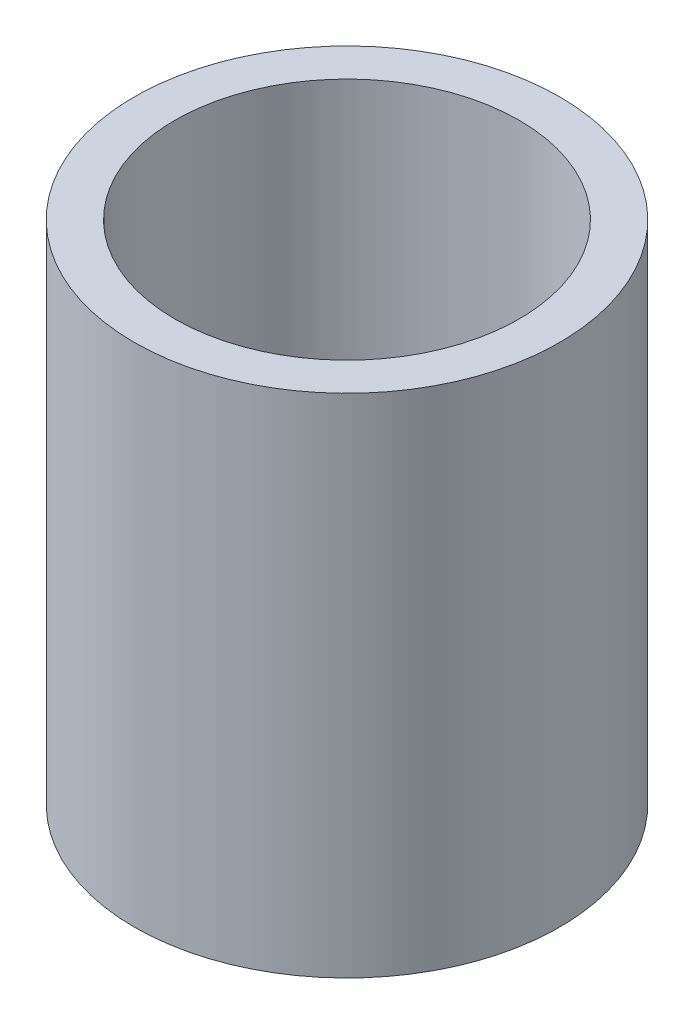
from build123d import *

# Parameters (mm, degrees)
SKETCH1_R           = 3.15
SKETCH1_R_2         = 2.55
BOSS_EXTRUDE1_DEPTH = 7.5


with BuildPart() as part:
    # Sketch1 → Boss-Extrude1 (new body)
    with BuildSketch(Plane(origin=(0, 0, 0), x_dir=(1, 0, 0), z_dir=(0, 1, 0))):
        Circle(SKETCH1_R)
        Circle(SKETCH1_R_2, mode=Mode.SUBTRACT)
    extrude(amount=BOSS_EXTRUDE1_DEPTH)


solid = part.part
